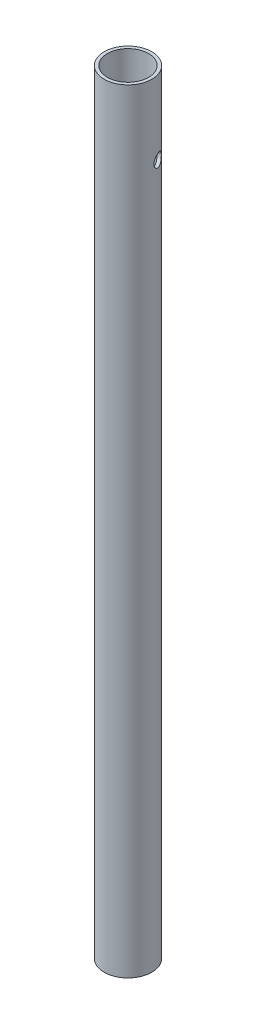
from build123d import *

# Parameters (mm, degrees)
SKETCH_1_R          = 15
SKETCH_1_R_2        = 13
EXTRUDE_1_DEPTH     = 487
SKETCH_5_R          = 4
CUT_EXTRUDE_1_DEPTH = 47.5


with BuildPart() as part:
    # Эскиз1 → Вытянуть1 (new body)
    with BuildSketch(Plane(origin=(0, 0, 0), x_dir=(1, 0, 0), z_dir=(0, 1, 0))):
        Circle(SKETCH_1_R)
        Circle(SKETCH_1_R_2, mode=Mode.SUBTRACT)
    extrude(amount=EXTRUDE_1_DEPTH)

    # Эскиз5 → Вырез-Вытянуть1 (cut, symmetric)
    with BuildSketch(Plane(origin=(-19.177553223, 0, 7.243718229), x_dir=(0.353352108149494, 0, 0.9354903995585997), z_dir=(-0.9354903995585997, 0, 0.353352108149494))):
        with Locations((0, 440)):
            Circle(SKETCH_5_R)
    extrude(amount=CUT_EXTRUDE_1_DEPTH, both=True, mode=Mode.SUBTRACT)


solid = part.part
